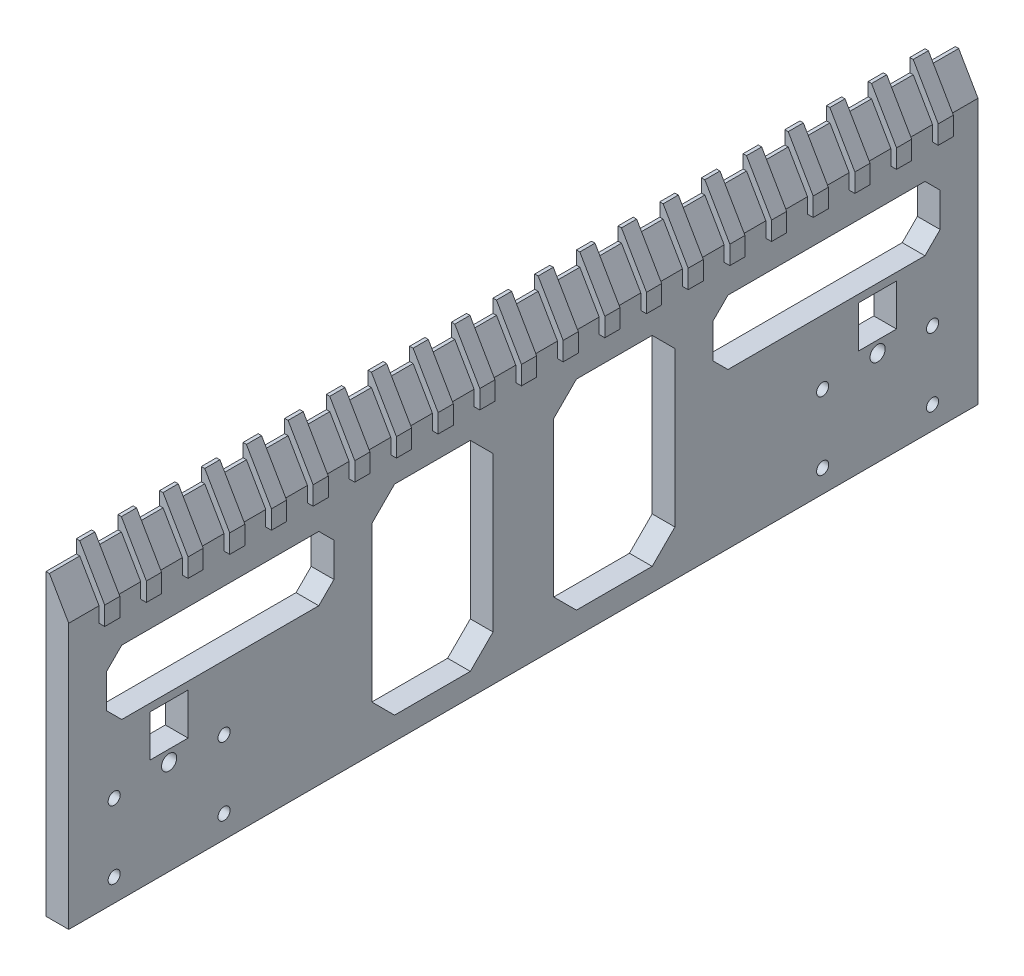
from build123d import *

# Parameters (mm, degrees)
SKETCH_1_W                  = 240
SKETCH_1_H                  = 70
EXTRUDE_1_DEPTH             = 6
CUT_EXTRUDE_2_DEPTH         = 251.071989635
EXTRUDE_2_DEPTH             = 240
EXTRUDE_3_DEPTH             = 2
PATTERN_LINEAR_1_COUNT      = 11
PATTERN_LINEAR_1_PITCH      = 11
PATTERN_LINEAR_1_COUNT_DIR2 = 11
PATTERN_LINEAR_1_PITCH_DIR2 = 11
HOLE_WIZARD_1_D             = 3.2
HOLE_WIZARD_1_CBORE_D       = 6
HOLE_WIZARD_1_CBORE_DEPTH   = 3.4
SKETCH_16_R                 = 2
CUT_EXTRUDE_3_DEPTH         = 10
SKETCH_17_W                 = 10
SKETCH_17_H                 = 11
CUT_EXTRUDE_4_DEPTH         = 251.112474699


with BuildPart() as part:
    # 草图1 → 凸台-拉伸1 (new body)
    with BuildSketch(Plane(origin=(0, 0, 0), x_dir=(0, 0, -1), z_dir=(1, 0, 0))):
        with Locations((120, -35)):
            Rectangle(SKETCH_1_W, SKETCH_1_H)
    extrude(amount=EXTRUDE_1_DEPTH)

    # 草图3 → 切除-拉伸2 (cut, through all)
    with BuildSketch(Plane(origin=(6, 0, 0), x_dir=(0, 0, -1), z_dir=(1, 0, 0))):
        Polygon((14, -12), (66, -12), (70, -16), (70, -25), (66, -29), (14, -29), (10, -25), (10, -16), align=None)
        Polygon((80, -17.2), (86, -11.2), (106, -11.2), (112, -17.2), (112, -58), (106, -64), (86, -64), (80, -58), align=None)
    cut_extrude_2 = extrude(amount=-CUT_EXTRUDE_2_DEPTH, mode=Mode.SUBTRACT)

    # 草图6 → 凸台-拉伸2 (add)
    with BuildSketch(Plane.XY):
        Polygon((6, 0), (0, 0), (0, 8.833459119), (0.9, 8.833459119), align=None)
    extrude(amount=-EXTRUDE_2_DEPTH)

    # 草图8 → 凸台-拉伸3 (add, symmetric)
    with BuildSketch(Plane.XY.offset(-120)):
        Polygon((0, 10.392304845), (0, 12.333459119), (0.9, 12.333459119), (7.5, 0.901923789), (7.5, -4), (6, -4), (6, 0), (0.9, 8.833459119), (0, 8.833459119), align=None)
    extrude_3 = extrude(amount=EXTRUDE_3_DEPTH, both=True)

    # 阵列(线性)1: Extrude 3 11 × 11
    with Locations(*[Vector(0, 0, 1) * (i * PATTERN_LINEAR_1_PITCH) + Vector(0, 0, -1) * (j * PATTERN_LINEAR_1_PITCH_DIR2) for i in range(PATTERN_LINEAR_1_COUNT) for j in range(PATTERN_LINEAR_1_COUNT_DIR2) if (i, j) != (0, 0)]):
        add(extrude_3)

    # 打孔尺寸(%根据)内六角圆柱头螺钉的类型1 (through all)
    with Locations(Plane.ZY):
        with Locations((-41, -46), (-12, -46), (-12, -64), (-41, -64)):
            hole_wizard_1 = CounterBoreHole(HOLE_WIZARD_1_D / 2, HOLE_WIZARD_1_CBORE_D / 2, HOLE_WIZARD_1_CBORE_DEPTH)

    # 草图16 → 切除-拉伸3 (cut)
    with BuildSketch(Plane.ZY):
        with Locations((-26.5, -45.023268437)):
            Circle(SKETCH_16_R)
    cut_extrude_3 = extrude(amount=-CUT_EXTRUDE_3_DEPTH, mode=Mode.SUBTRACT)

    # 镜向1: 打孔尺寸(%根据)内六角圆柱头螺钉的类型1 across plane
    add(hole_wizard_1.mirror(Plane.XY.offset(-120)), mode=Mode.SUBTRACT)

    # 镜向2: 切除-拉伸2, 切除-拉伸3 across plane
    add(cut_extrude_2.mirror(Plane.XY.offset(-120)), mode=Mode.SUBTRACT)
    add(cut_extrude_3.mirror(Plane.XY.offset(-120)), mode=Mode.SUBTRACT)

    # 草图17 → 切除-拉伸4 (cut, through all)
    with BuildSketch(Plane.ZY):
        with Locations((-26.5, -36.5)):
            Rectangle(SKETCH_17_W, SKETCH_17_H)
        with Locations((-213.5, -36.5)):
            Rectangle(SKETCH_17_W, SKETCH_17_H)
    extrude(amount=-CUT_EXTRUDE_4_DEPTH, mode=Mode.SUBTRACT)


solid = part.part
